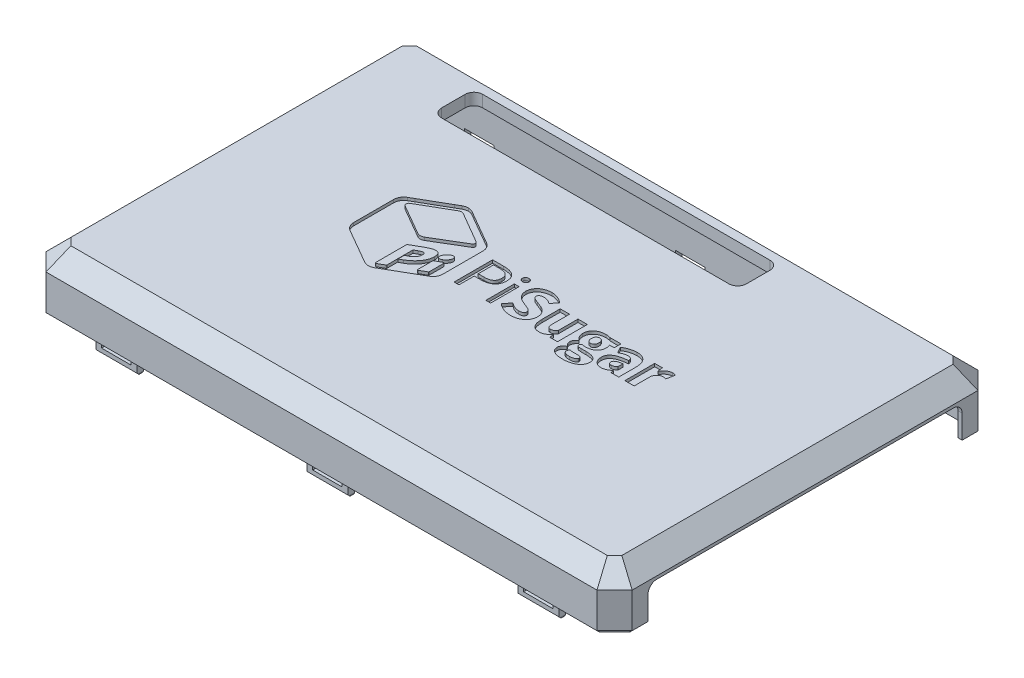
from build123d import *

# Parameters (mm, degrees)
SKETCH_1_W           = 100
SKETCH_1_H           = 65
EXTRUDE_1_DEPTH      = 2
SKETCH_4_W           = 100
SKETCH_4_H           = 65
SKETCH_4_W_2         = 95.8
SKETCH_4_H_2         = 60.8
EXTRUDE_2_DEPTH      = 7
CHAMFER_4_SIZE       = 2
CHAMFER_5_SIZE       = 3
CHAMFER_7_SIZE       = 3
SKETCH_24_W          = 56.6
SKETCH_24_H          = 6
CUT_EXTRUDE_8_DEPTH  = 1.4
FILLET_9_R           = 2
CUT_EXTRUDE_9_DEPTH  = 11.4
EXTRUDE_9_DEPTH      = 1
SKETCH_29_W          = 0.815007944
SKETCH_29_H          = 4.866639491
CUT_EXTRUDE_12_DEPTH = 0.5
SKETCH_30_W          = 2.416645626
SKETCH_30_H          = 1.5
EXTRUDE_10_DEPTH     = 3.3
CHAMFER_8_SIZE       = 1
CUT_EXTRUDE_13_REACH = 62.467
SKETCH_31_W          = 52
SKETCH_31_H          = 7
FILLET_10_R          = 1.5
SKETCH_33_W          = 1.5
SKETCH_33_H          = 10
EXTRUDE_11_DEPTH     = 2
SKETCH_21_W          = 20
SKETCH_21_H          = 2
CUT_EXTRUDE_15_DEPTH = 5
FILLET_11_R          = 1
CHAMFER_9_SIZE       = 1
CHAMFER_10_SIZE      = 0.8
SKETCH_34_W          = 7
SKETCH_34_H          = 2.8
EXTRUDE_12_DEPTH     = 1.1
SKETCH_35_W          = 7
SKETCH_35_H          = 2.8
EXTRUDE_13_DEPTH     = 1.1
CUT_EXTRUDE_16_REACH = 83.829
SKETCH_36_W          = 5
SKETCH_36_H          = 1.5
CUT_EXTRUDE_17_REACH = 83.829
SKETCH_37_W          = 5
SKETCH_37_H          = 1.5
CHAMFER_11_SIZE      = 0.6
FILLET_12_R          = 0.4


# Some blends are built 0.0001 mm under size
with BuildPart() as part:
    # 草图1 → 凸台-拉伸1 (new body)
    with BuildSketch(Plane(origin=(0, 0, 0), x_dir=(1, 0, 0), z_dir=(0, 1, 0))):
        Rectangle(SKETCH_1_W, SKETCH_1_H)
    extrude(amount=EXTRUDE_1_DEPTH)

    # 草图4 → 凸台-拉伸2 (add)
    with BuildSketch(Plane.XZ):
        Rectangle(SKETCH_4_W, SKETCH_4_H)
        Rectangle(SKETCH_4_W_2, SKETCH_4_H_2, mode=Mode.SUBTRACT)
    extrude(amount=EXTRUDE_2_DEPTH)

    # 倒角4
    chamfer_4_edges = [part.edges().sort_by_distance(p)[0] for p in [
        (47.9, -3.5, 30.4),
        (-47.9, -3.5, 30.4),
        (-47.9, -3.5, -30.4),
        (47.9, -3.5, -30.4),
    ]]
    chamfer(chamfer_4_edges, length=CHAMFER_4_SIZE)

    # 倒角5
    chamfer_5_edges = [part.edges().sort_by_distance(p)[0] for p in [
        (50, -2.5, 32.5),
        (-50, -2.5, 32.5),
        (-50, -2.5, -32.5),
        (50, -2.5, -32.5),
    ]]
    chamfer(chamfer_5_edges, length=CHAMFER_5_SIZE)

    # 倒角7
    chamfer_7_edges = [part.edges().sort_by_distance(p)[0] for p in [
        (-50, 2, 0),
        (0, 2, -32.5),
        (50, 2, 0),
        (0, 2, 32.5),
        (48.5, 2, 31),
        (48.5, 2, -31),
        (-48.5, 2, 31),
        (-48.5, 2, -31),
    ]]
    chamfer(chamfer_7_edges, length=CHAMFER_7_SIZE)

    # 草图24 → 切除-拉伸8 (cut)
    with BuildSketch(Plane.ZY.offset(-47.9)):
        with Locations((0, -4)):
            Rectangle(SKETCH_24_W, SKETCH_24_H)
    extrude(amount=-CUT_EXTRUDE_8_DEPTH, mode=Mode.SUBTRACT)

    # 圆角9
    fillet_9_edges = [part.edges().sort_by_distance(p)[0] for p in [
        (48.6, -1, -28.3),
        (48.6, -1, 28.3),
    ]]
    fillet(fillet_9_edges, radius=FILLET_9_R)

    # 草图25 → 切除-拉伸9 (cut)
    with BuildSketch(Plane.ZY.offset(-49.3)):
        with BuildLine():
            Line((26.8, -7), (26.8, -3))
            ThreePointArc((26.8, -3), (26.360660172, -1.939339828), (25.3, -1.5))
            Line((25.3, -1.5), (-25.3, -1.5))
            ThreePointArc((-25.3, -1.5), (-26.360660172, -1.939339828), (-26.8, -3))
            Line((-26.8, -3), (-26.8, -7))
            Line((-26.8, -7), (26.8, -7))
        make_face()
    extrude(amount=-CUT_EXTRUDE_9_DEPTH, mode=Mode.SUBTRACT)

    # 草图26 → 凸台-拉伸9 (add)
    with BuildSketch(Plane.XZ.offset(7)):
        Polygon((45.9, 30.4), (47.9, 28.4), (47.9, 28.3), (49, 28.3), (49, 28.855634919), (46.355634919, 31.5), (-46.355634919, 31.5), (-49, 28.855634919), (-49, -28.855634919), (-46.355634919, -31.5), (46.355634919, -31.5), (49, -28.855634919), (49, -28.3), (47.9, -28.3), (47.9, -28.4), (45.9, -30.4), (-45.9, -30.4), (-47.9, -28.4), (-47.9, 28.4), (-45.9, 30.4), align=None)
    extrude(amount=EXTRUDE_9_DEPTH)

    # 草图29 → 切除-拉伸12 (cut)
    # profile 1 of 9: a face of its own
    with BuildSketch(Plane(origin=(0, 2, 0), x_dir=(1, 0, 0), z_dir=(0, 1, 0))):
        with BuildLine():
            Line((-10.686897547, 6.359972587), (-11.507470584, 6.832970753))
            Line((-11.507470584, 6.832970753), (-15.764349736, 9.289089991))
            Line((-15.764349736, 9.289089991), (-16.584922773, 9.767792378))
            add(Edge.make_bspline(
                [(-16.584922773, 9.767792378), (-16.852812462, 9.915928211), (-17.149084128, 9.995717739), (-17.445425357, 9.995717739)],
                knots=[3, 3, 3, 3, 4, 4, 4, 4], degree=3))
            add(Edge.make_bspline(
                [(-17.445425357, 9.995717739), (-17.741766586, 9.995717739), (-18.038107815, 9.915928211), (-18.305927941, 9.767792378)],
                knots=[4, 4, 4, 4, 5, 5, 5, 5], degree=3))
            Line((-18.305927941, 9.767792378), (-19.126570542, 9.289089991))
            Line((-19.126570542, 9.289089991), (-23.383449693, 6.832970753))
            Line((-23.383449693, 6.832970753), (-24.204092294, 6.359972587))
            add(Edge.make_bspline(
                [(-24.204092294, 6.359972587), (-24.734028324, 6.052257698), (-25.064594878, 5.482392123), (-25.064594878, 4.872631784)],
                knots=[8, 8, 8, 8, 9, 9, 9, 9], degree=3))
            Line((-25.064594878, 4.872631784), (-25.064594878, -1.942973017))
            add(Edge.make_bspline(
                [(-25.064594878, -1.942973017), (-25.064594878, -2.558402795), (-24.734028324, -3.122598931), (-24.204092294, -3.43031382)],
                knots=[10, 10, 10, 10, 11, 11, 11, 11], degree=3))
            Line((-24.204092294, -3.43031382), (-23.383449693, -3.903311987))
            Line((-23.383449693, -3.903311987), (-19.126570542, -6.359431224))
            Line((-19.126570542, -6.359431224), (-18.305927941, -6.83809883))
            add(Edge.make_bspline(
                [(-18.305927941, -6.83809883), (-18.038107815, -6.991973665), (-17.741766586, -7.066058973), (-17.445425357, -7.066058973)],
                knots=[14, 14, 14, 14, 15, 15, 15, 15], degree=3))
            add(Edge.make_bspline(
                [(-17.445425357, -7.066058973), (-17.149084128, -7.066058973), (-16.852812462, -6.991973665), (-16.584922773, -6.83809883)],
                knots=[15, 15, 15, 15, 16, 16, 16, 16], degree=3))
            Line((-16.584922773, -6.83809883), (-15.764349736, -6.359431224))
            Line((-15.764349736, -6.359431224), (-11.507470584, -3.903311987))
            Line((-11.507470584, -3.903311987), (-10.686897547, -3.43031382))
            add(Edge.make_bspline(
                [(-10.686897547, -3.43031382), (-10.151187733, -3.122598931), (-9.826394963, -2.558402795), (-9.826394963, -1.942973017)],
                knots=[19, 19, 19, 19, 20, 20, 20, 20], degree=3))
            Line((-9.826394963, -1.942973017), (-9.826394963, 4.872631784))
            add(Edge.make_bspline(
                [(-9.826394963, 4.872631784), (-9.826394963, 5.482392123), (-10.151187733, 6.052257698), (-10.686897547, 6.359972587)],
                knots=[21, 21, 21, 21, 22, 22, 22, 22], degree=3))
        make_face()
        with BuildLine():
            Line((-23.109925347, 5.681831161), (-17.844372998, 8.724928637))
            add(Edge.make_bspline(
                [(-17.844372998, 8.724928637), (-17.599300192, 8.867395031), (-17.291550521, 8.867395031), (-17.040843059, 8.724928637)],
                knots=[3, 3, 3, 3, 4, 4, 4, 4], degree=3))
            Line((-17.040843059, 8.724928637), (-11.803811814, 5.676126941))
            add(Edge.make_bspline(
                [(-11.803811814, 5.676126941), (-11.535991689, 5.522286887), (-11.530287468, 5.13478247), (-11.798107593, 4.975203413)],
                knots=[5, 5, 5, 5, 6, 6, 6, 6], degree=3))
            Line((-11.798107593, 4.975203413), (-16.886968223, 1.93214072))
            add(Edge.make_bspline(
                [(-16.886968223, 1.93214072), (-17.228943219, 1.732666899), (-17.656342401, 1.732666899), (-17.998247833, 1.93214072)],
                knots=[7, 7, 7, 7, 8, 8, 8, 8], degree=3))
            add(Edge.make_bspline(
                [(-17.998247833, 1.93214072), (-23.149785329, 4.906822327), (-23.161193771, 4.912526548)],
                knots=[0, 0, 0, 1, 1, 1], degree=2))
            add(Edge.make_bspline(
                [(-23.161193771, 4.912526548), (-23.429013896, 5.106261365), (-23.400562356, 5.516582666), (-23.109925347, 5.681831161)],
                knots=[1, 1, 1, 1, 2, 2, 2, 2], degree=3))
        make_face(mode=Mode.SUBTRACT)
        with BuildLine():
            Line((-15.30842945, -3.225170561), (-15.901111909, -3.555667552))
            Line((-15.901111909, -3.555667552), (-15.901111909, -2.472943828))
            Line((-15.901111909, -2.472943828), (-15.3768801, -2.210793142))
            add(Edge.make_bspline(
                [(-14.419475326, -0.826023968), (-14.419475326, -1.367403221), (-14.727155433, -1.846070826), (-15.3768801, -2.210793142)],
                knots=[0, 0, 0, 0, 1, 1, 1, 1], degree=3))
            add(Edge.make_bspline(
                [(-15.411035862, -0.637958589), (-14.7727892, -0.273271055), (-14.419475326, -0.267566835), (-14.419475326, -0.826023968)],
                knots=[6, 6, 6, 6, 7, 7, 7, 7], degree=3))
            Line((-15.411035862, -0.637958589), (-15.901111909, -0.911517717))
            add(Edge.make_bspline(
                [(-15.958154117, -1.008385126), (-15.958154117, -0.968490362), (-15.935337234, -0.928595598), (-15.901111909, -0.911517717)],
                knots=[4, 4, 4, 4, 5, 5, 5, 5], degree=3))
            Line((-15.958154117, -1.008385126), (-15.958154117, -2.353259536))
            Line((-15.958154117, -2.353259536), (-15.958154117, -3.652569742))
            Line((-15.958154117, -3.652569742), (-15.958154117, -5.362166468))
            add(Edge.make_bspline(
                [(-15.958154117, -5.362166468), (-15.958154117, -5.402061232), (-15.975197216, -5.436251775), (-16.015057198, -5.459033877)],
                knots=[3, 3, 3, 3, 4, 4, 4, 4], degree=3))
            Line((-16.015057198, -5.459033877), (-17.120632587, -6.085872097))
            add(Edge.make_bspline(
                [(-17.120632587, -6.085872097), (-17.194717894, -6.125766861), (-17.285915864, -6.074498437), (-17.285915864, -5.989004688)],
                knots=[5, 5, 5, 5, 6, 6, 6, 6], degree=3))
            Line((-17.285915864, -5.989004688), (-17.285915864, -0.712043897))
            add(Edge.make_bspline(
                [(-17.285915864, -0.712043897), (-17.285915864, -0.672149133), (-17.268803202, -0.632254369), (-17.228943219, -0.615176488)],
                knots=[7, 7, 7, 7, 8, 8, 8, 8], degree=3))
            Line((-17.228943219, -0.615176488), (-15.348358996, 0.450469355))
            add(Edge.make_bspline(
                [(-15.348358996, 0.450469355), (-14.128838317, 1.140019223), (-13.120234683, 1.276781396), (-13.120234683, -0.090909898)],
                knots=[9, 9, 9, 9, 10, 10, 10, 10], degree=3))
            add(Edge.make_bspline(
                [(-13.120234683, -0.090909898), (-13.120234683, -1.407297985), (-14.140246759, -2.564107016), (-15.30842945, -3.225170561)],
                knots=[10, 10, 10, 10, 11, 11, 11, 11], degree=3))
        make_face(mode=Mode.SUBTRACT)
        with BuildLine():
            Line((-11.404933737, -2.871856687), (-12.49903112, -3.492990686))
            add(Edge.make_bspline(
                [(-12.49903112, -3.492990686), (-12.573116427, -3.53288545), (-12.664314397, -3.481582244), (-12.664314397, -3.396123277)],
                knots=[2, 2, 2, 2, 3, 3, 3, 3], degree=3))
            Line((-12.664314397, -3.396123277), (-12.664314397, -0.882996613))
            add(Edge.make_bspline(
                [(-12.664314397, -0.882996613), (-12.664314397, -0.843136631), (-12.641497514, -0.808911306), (-12.607272189, -0.786129204)],
                knots=[4, 4, 4, 4, 5, 5, 5, 5], degree=3))
            Line((-12.607272189, -0.786129204), (-11.513174805, -0.170664644))
            add(Edge.make_bspline(
                [(-11.513174805, -0.170664644), (-11.439089498, -0.130804662), (-11.347891528, -0.182073086), (-11.347891528, -0.267566835)],
                knots=[6, 6, 6, 6, 7, 7, 7, 7], degree=3))
            Line((-11.347891528, -0.267566835), (-11.347891528, -2.774954496))
            add(Edge.make_bspline(
                [(-11.347891528, -2.774954496), (-11.347891528, -2.81484926), (-11.370708412, -2.854744024), (-11.404933737, -2.871856687)],
                knots=[0, 0, 0, 0, 1, 1, 1, 1], degree=3))
        make_face(mode=Mode.SUBTRACT)
        with BuildLine():
            add(Edge.make_bspline(
                [(-12.003250852, 1.499037317), (-11.564443229, 1.749779562), (-11.251058901, 1.641503711), (-11.251058901, 1.242590852), (-11.251058901, 0.849382214), (-11.564443229, 0.38779249), (-12.003250852, 0.142754466)],
                knots=[2, 2, 2, 2, 3, 3, 3, 4, 4, 4, 4], degree=3))
            add(Edge.make_bspline(
                [(-12.003250852, 0.142754466), (-12.447693133, -0.113691999), (-12.761147024, -0.005416149), (-12.761147024, 0.38779249), (-12.761147024, 0.792409569), (-12.447693133, 1.248295073), (-12.003250852, 1.499037317)],
                knots=[0, 0, 0, 0, 1, 1, 1, 2, 2, 2, 2], degree=3))
        make_face(mode=Mode.SUBTRACT)
    # profile 2 of 9: a face of its own
    with BuildSketch(Plane(origin=(0, 2, 0), x_dir=(1, 0, 0), z_dir=(0, 1, 0))):
        with BuildLine():
            Line((-5.831631716, 4.393929396), (-7.706511719, 4.393929396))
            Line((-7.706511719, 4.393929396), (-7.706511719, -2.170898378))
            Line((-7.706511719, -2.170898378), (-6.874460676, -2.170898378))
            Line((-6.874460676, -2.170898378), (-6.874460676, 0.433391474))
            Line((-6.874460676, 0.433391474), (-5.785997949, 0.433391474))
            add(Edge.make_bspline(
                [(-5.785997949, 0.433391474), (-4.355629791, 0.433391474), (-3.369773476, 1.083011796), (-3.369773476, 2.467815752)],
                knots=[5, 5, 5, 5, 6, 6, 6, 6], degree=3))
            add(Edge.make_bspline(
                [(-3.369773476, 2.467815752), (-3.369773476, 3.903853349), (-4.355629791, 4.393929396), (-5.831631716, 4.393929396)],
                knots=[6, 6, 6, 6, 7, 7, 7, 7], degree=3))
        make_face()
        with BuildLine():
            Line((-5.894239018, 1.105828679), (-6.874460676, 1.105828679))
            Line((-6.874460676, 1.105828679), (-6.874460676, 3.721492192))
            Line((-6.874460676, 3.721492192), (-5.928464343, 3.721492192))
            add(Edge.make_bspline(
                [(-5.928464343, 3.721492192), (-4.777324751, 3.721492192), (-4.196050734, 3.419481523), (-4.196050734, 2.467815752)],
                knots=[3, 3, 3, 3, 4, 4, 4, 4], degree=3))
            add(Edge.make_bspline(
                [(-4.196050734, 2.467815752), (-4.196050734, 1.52752364), (-4.737464769, 1.105828679), (-5.894239018, 1.105828679)],
                knots=[4, 4, 4, 4, 5, 5, 5, 5], degree=3))
        make_face(mode=Mode.SUBTRACT)
    # profile 3 of 9: a face of its own
    with BuildSketch(Plane(origin=(0, 2, 0), x_dir=(1, 0, 0), z_dir=(0, 1, 0))):
        with Locations((-1.885284783, 0.262421368)):
            Rectangle(SKETCH_29_W, SKETCH_29_H)
    # profile 4 of 9: a face of its own
    with BuildSketch(Plane(origin=(0, 2, 0), x_dir=(1, 0, 0), z_dir=(0, 1, 0))):
        with BuildLine():
            Line((3.229244842, 1.618686828), (2.397263362, 1.9492186))
            add(Edge.make_bspline(
                [(2.397263362, 1.9492186), (1.810285125, 2.182882964), (1.388590164, 2.325349358), (1.388590164, 2.695741113)],
                knots=[1, 1, 1, 1, 2, 2, 2, 2], degree=3))
            add(Edge.make_bspline(
                [(1.388590164, 2.695741113), (1.388590164, 3.049054987), (1.690635614, 3.248528807), (2.186415882, 3.248528807)],
                knots=[2, 2, 2, 2, 3, 3, 3, 3], degree=3))
            add(Edge.make_bspline(
                [(2.186415882, 3.248528807), (2.70494347, 3.248528807), (3.115299552, 3.07187187), (3.554037612, 2.735635877)],
                knots=[3, 3, 3, 3, 4, 4, 4, 4], degree=3))
            Line((3.554037612, 2.735635877), (4.351932893, 3.738604854))
            add(Edge.make_bspline(
                [(4.351932893, 3.738604854), (3.770658876, 4.32554831), (2.955720496, 4.621889539), (2.186415882, 4.621889539)],
                knots=[5, 5, 5, 5, 6, 6, 6, 6], degree=3))
            add(Edge.make_bspline(
                [(2.186415882, 4.621889539), (0.767456165, 4.621889539), (-0.235512812, 3.721492192), (-0.235512812, 2.604577925)],
                knots=[6, 6, 6, 6, 7, 7, 7, 7], degree=3))
            add(Edge.make_bspline(
                [(-0.235512812, 2.604577925), (-0.235512812, 1.63579949), (0.419776948, 1.054525474), (1.120770039, 0.775296907)],
                knots=[7, 7, 7, 7, 8, 8, 8, 8], degree=3))
            Line((1.120770039, 0.775296907), (1.969864181, 0.416278812))
            add(Edge.make_bspline(
                [(1.969864181, 0.416278812), (2.539729756, 0.176945009), (2.910156293, 0.051556496), (2.910156293, -0.335947921)],
                knots=[9, 9, 9, 9, 10, 10, 10, 10], degree=3))
            add(Edge.make_bspline(
                [(2.910156293, -0.335947921), (2.910156293, -0.694966016), (2.630927726, -0.917187156), (2.038245267, -0.917187156)],
                knots=[10, 10, 10, 10, 11, 11, 11, 11], degree=3))
            add(Edge.make_bspline(
                [(2.038245267, -0.917187156), (1.514013459, -0.917187156), (0.892809896, -0.637958589), (0.419776948, -0.233376291)],
                knots=[11, 11, 11, 11, 12, 12, 12, 12], degree=3))
            Line((0.419776948, -0.233376291), (-0.486220275, -1.338916899))
            add(Edge.make_bspline(
                [(-0.486220275, -1.338916899), (0.203294811, -1.971459339), (1.137813138, -2.296286891), (2.004019942, -2.296286891)],
                knots=[13, 13, 13, 13, 14, 14, 14, 14], degree=3))
            add(Edge.make_bspline(
                [(2.004019942, -2.296286891), (3.616784041, -2.296286891), (4.551302368, -1.321804236), (4.551302368, -0.210559408)],
                knots=[14, 14, 14, 14, 15, 15, 15, 15], degree=3))
            add(Edge.make_bspline(
                [(4.551302368, -0.210559408), (4.551302368, 0.729697922), (4.055591664, 1.288189837), (3.229244842, 1.618686828)],
                knots=[15, 15, 15, 15, 16, 16, 16, 16], degree=3))
        make_face()
    # profile 5 of 9: a face of its own
    with BuildSketch(Plane(origin=(0, 2, 0), x_dir=(1, 0, 0), z_dir=(0, 1, 0))):
        with BuildLine():
            Line((8.335287698, 2.923701255), (8.335287698, -0.415737449))
            add(Edge.make_bspline(
                [(8.335287698, -0.415737449), (8.067467573, -0.791833425), (7.845142088, -0.934299819), (7.486193557, -0.934299819)],
                knots=[1, 1, 1, 1, 2, 2, 2, 2], degree=3))
            add(Edge.make_bspline(
                [(7.486193557, -0.934299819), (7.081541695, -0.934299819), (6.893511098, -0.73486078), (6.893511098, -0.02819825)],
                knots=[2, 2, 2, 2, 3, 3, 3, 3], degree=3))
            Line((6.893511098, -0.02819825), (6.893511098, 2.923701255))
            Line((6.893511098, 2.923701255), (5.303563883, 2.923701255))
            Line((5.303563883, 2.923701255), (5.303563883, -0.227672071))
            add(Edge.make_bspline(
                [(5.303563883, -0.227672071), (5.303563883, -1.498461173), (5.776596831, -2.296286891), (6.887806877, -2.296286891)],
                knots=[6, 6, 6, 6, 7, 7, 7, 7], degree=3))
            add(Edge.make_bspline(
                [(6.887806877, -2.296286891), (7.583026184, -2.296286891), (8.061763353, -1.971459339), (8.483458313, -1.469974851)],
                knots=[7, 7, 7, 7, 8, 8, 8, 8], degree=3))
            Line((8.483458313, -1.469974851), (8.517614075, -1.469974851))
            Line((8.517614075, -1.469974851), (8.631628928, -2.170898378))
            Line((8.631628928, -2.170898378), (9.930869571, -2.170898378))
            Line((9.930869571, -2.170898378), (9.930869571, 2.923701255))
            Line((9.930869571, 2.923701255), (8.335287698, 2.923701255))
        make_face()
    # profile 6 of 9: a face of its own
    with BuildSketch(Plane(origin=(0, 2, 0), x_dir=(1, 0, 0), z_dir=(0, 1, 0))):
        with BuildLine():
            Line((13.783166424, -1.1679294), (12.979636485, -1.1679294))
            add(Edge.make_bspline(
                [(12.979636485, -1.1679294), (12.432587793, -1.1679294), (12.227444534, -1.05965355), (12.227444534, -0.826023968)],
                knots=[1, 1, 1, 1, 2, 2, 2, 2], degree=3))
            add(Edge.make_bspline(
                [(12.227444534, -0.826023968), (12.227444534, -0.655071252), (12.267304516, -0.575281724), (12.386954027, -0.467005873)],
                knots=[2, 2, 2, 2, 3, 3, 3, 3], degree=3))
            add(Edge.make_bspline(
                [(12.386954027, -0.467005873), (12.609279512, -0.529682739), (12.814353208, -0.558203843), (12.985340706, -0.558203843)],
                knots=[3, 3, 3, 3, 4, 4, 4, 4], degree=3))
            add(Edge.make_bspline(
                [(12.985340706, -0.558203843), (14.113663415, -0.558203843), (15.019799765, -0.039606692), (15.019799765, 1.151392882)],
                knots=[4, 4, 4, 4, 5, 5, 5, 5], degree=3))
            add(Edge.make_bspline(
                [(15.019799765, 1.151392882), (15.019799765, 1.396465688), (14.957053336, 1.63009527), (14.877333371, 1.772561663)],
                knots=[5, 5, 5, 5, 6, 6, 6, 6], degree=3))
            Line((14.877333371, 1.772561663), (15.663681084, 1.772561663))
            Line((15.663681084, 1.772561663), (15.663681084, 2.923701255))
            Line((15.663681084, 2.923701255), (13.794574866, 2.923701255))
            add(Edge.make_bspline(
                [(13.794574866, 2.923701255), (13.560910502, 3.009160223), (13.281681935, 3.049054987), (12.985340706, 3.049054987)],
                knots=[9, 9, 9, 9, 10, 10, 10, 10], degree=3))
            add(Edge.make_bspline(
                [(12.985340706, 3.049054987), (11.885539102, 3.049054987), (10.85404902, 2.444998868), (10.85404902, 1.196991867)],
                knots=[10, 10, 10, 10, 11, 11, 11, 11], degree=3))
            add(Edge.make_bspline(
                [(10.85404902, 1.196991867), (10.85404902, 0.604344191), (11.184615574, 0.131346024), (11.543564106, -0.11939622)],
                knots=[11, 11, 11, 11, 12, 12, 12, 12], degree=3))
            Line((11.543564106, -0.11939622), (11.543564106, -0.153586763))
            add(Edge.make_bspline(
                [(11.543564106, -0.153586763), (11.213067115, -0.387216345), (10.979402751, -0.74623444), (10.979402751, -1.105252535)],
                knots=[13, 13, 13, 13, 14, 14, 14, 14], degree=3))
            add(Edge.make_bspline(
                [(10.979402751, -1.105252535), (10.979402751, -1.532651716), (11.178911353, -1.800506623), (11.446731479, -1.982867781)],
                knots=[14, 14, 14, 14, 15, 15, 15, 15], degree=3))
            Line((11.446731479, -1.982867781), (11.446731479, -2.028431984))
            add(Edge.make_bspline(
                [(11.446731479, -2.028431984), (10.97369853, -2.267800569), (10.722991068, -2.609706001), (10.722991068, -3.031400961)],
                knots=[16, 16, 16, 16, 17, 17, 17, 17], degree=3))
            add(Edge.make_bspline(
                [(10.722991068, -3.031400961), (10.722991068, -3.943171969), (11.686030499, -4.313598506), (12.859986975, -4.313598506)],
                knots=[17, 17, 17, 17, 18, 18, 18, 18], degree=3))
            add(Edge.make_bspline(
                [(12.859986975, -4.313598506), (14.632260566, -4.313598506), (15.743540176, -3.549998113), (15.743540176, -2.472943828)],
                knots=[18, 18, 18, 18, 19, 19, 19, 19], degree=3))
            add(Edge.make_bspline(
                [(15.743540176, -2.472943828), (15.743540176, -1.549764379), (15.036912428, -1.1679294), (13.783166424, -1.1679294)],
                knots=[19, 19, 19, 19, 20, 20, 20, 20], degree=3))
        make_face()
        with BuildLine():
            Line((12.996749148, -2.387450079), (13.481190538, -2.387450079))
            add(Edge.make_bspline(
                [(13.481190538, -2.387450079), (13.954084358, -2.387450079), (14.221974047, -2.450126945), (14.221974047, -2.752172395)],
                knots=[4, 4, 4, 4, 5, 5, 5, 5], degree=3))
            add(Edge.make_bspline(
                [(14.221974047, -2.752172395), (14.221974047, -3.076999946), (13.766123325, -3.316333749), (13.110694437, -3.316333749)],
                knots=[5, 5, 5, 5, 6, 6, 6, 6], degree=3))
            add(Edge.make_bspline(
                [(13.110694437, -3.316333749), (12.455404677, -3.316333749), (12.028005495, -3.139676812), (12.028005495, -2.780658717)],
                knots=[0, 0, 0, 0, 1, 1, 1, 1], degree=3))
            add(Edge.make_bspline(
                [(12.028005495, -2.780658717), (12.028005495, -2.609706001), (12.10772546, -2.467239607), (12.267304516, -2.324773213)],
                knots=[1, 1, 1, 1, 2, 2, 2, 2], degree=3))
            add(Edge.make_bspline(
                [(12.267304516, -2.324773213), (12.432587793, -2.370372198), (12.626392175, -2.387450079), (12.996749148, -2.387450079)],
                knots=[2, 2, 2, 2, 3, 3, 3, 3], degree=3))
        make_face(mode=Mode.SUBTRACT)
        with BuildLine():
            add(Edge.make_bspline(
                [(12.985340706, 0.399200931), (12.620687954, 0.399200931), (12.341459387, 0.667021056), (12.341459387, 1.196991867), (12.341459387, 1.715589019), (12.620687954, 1.983409144), (12.985340706, 1.983409144)],
                knots=[2, 2, 2, 2, 3, 3, 3, 4, 4, 4, 4], degree=3))
            add(Edge.make_bspline(
                [(12.985340706, 1.983409144), (13.361471463, 1.983409144), (13.629291588, 1.715589019), (13.629291588, 1.196991867), (13.629291588, 0.667021056), (13.361471463, 0.399200931), (12.985340706, 0.399200931)],
                knots=[0, 0, 0, 0, 1, 1, 1, 2, 2, 2, 2], degree=3))
        make_face(mode=Mode.SUBTRACT)
    # profile 7 of 9: a face of its own
    with BuildSketch(Plane(origin=(0, 2, 0), x_dir=(1, 0, 0), z_dir=(0, 1, 0))):
        with BuildLine():
            Line((16.119601369, 2.382322003), (16.678058503, 1.33375404))
            add(Edge.make_bspline(
                [(16.678058503, 1.33375404), (17.185316776, 1.618686828), (17.607011737, 1.778265884), (18.011594035, 1.778265884)],
                knots=[2, 2, 2, 2, 3, 3, 3, 3], degree=3))
            add(Edge.make_bspline(
                [(18.011594035, 1.778265884), (18.530121622, 1.778265884), (18.746742887, 1.538932082), (18.780898648, 1.128610781)],
                knots=[3, 3, 3, 3, 4, 4, 4, 4], degree=3))
            add(Edge.make_bspline(
                [(18.780898648, 1.128610781), (16.792073356, 0.91205908), (15.948613871, 0.330819845), (15.948613871, -0.74623444)],
                knots=[4, 4, 4, 4, 5, 5, 5, 5], degree=3))
            add(Edge.make_bspline(
                [(15.948613871, -0.74623444), (15.948613871, -1.595328582), (16.524183667, -2.296286891), (17.464545343, -2.296286891)],
                knots=[5, 5, 5, 5, 6, 6, 6, 6], degree=3))
            add(Edge.make_bspline(
                [(17.464545343, -2.296286891), (18.028706697, -2.296286891), (18.501670082, -2.034136205), (18.923365042, -1.658040229)],
                knots=[6, 6, 6, 6, 7, 7, 7, 7], degree=3))
            Line((18.923365042, -1.658040229), (18.963225024, -1.658040229))
            Line((18.963225024, -1.658040229), (19.077170314, -2.170898378))
            Line((19.077170314, -2.170898378), (20.376480521, -2.170898378))
            Line((20.376480521, -2.170898378), (20.376480521, 0.723993701))
            add(Edge.make_bspline(
                [(20.376480521, 0.723993701), (20.376480521, 2.319645137), (19.62999279, 3.049054987), (18.313639485, 3.049054987)],
                knots=[11, 11, 11, 11, 12, 12, 12, 12], degree=3))
            add(Edge.make_bspline(
                [(18.313639485, 3.049054987), (17.521448424, 3.049054987), (16.792073356, 2.781234862), (16.119601369, 2.382322003)],
                knots=[0, 0, 0, 0, 1, 1, 1, 1], degree=3))
        make_face()
        with BuildLine():
            Line((18.780898648, 0.159832347), (18.780898648, -0.655071252))
            add(Edge.make_bspline(
                [(18.780898648, -0.655071252), (18.547234285, -0.905813496), (18.336386804, -1.05965355), (18.011594035, -1.05965355)],
                knots=[0, 0, 0, 0, 1, 1, 1, 1], degree=3))
            add(Edge.make_bspline(
                [(18.011594035, -1.05965355), (17.68102748, -1.05965355), (17.464545343, -0.917187156), (17.464545343, -0.620880709)],
                knots=[1, 1, 1, 1, 2, 2, 2, 2], degree=3))
            add(Edge.make_bspline(
                [(17.464545343, -0.620880709), (17.464545343, -0.261862614), (17.789338113, 0.023070174), (18.780898648, 0.159832347)],
                knots=[2, 2, 2, 2, 3, 3, 3, 3], degree=3))
        make_face(mode=Mode.SUBTRACT)
    # profile 8 of 9: a face of its own
    with BuildSketch(Plane(origin=(0, 2, 0), x_dir=(1, 0, 0), z_dir=(0, 1, 0))):
        with BuildLine():
            Line((22.866859865, 2.04041657), (22.83263454, 2.04041657))
            Line((22.83263454, 2.04041657), (22.724393471, 2.923701255))
            Line((22.724393471, 2.923701255), (21.425083265, 2.923701255))
            Line((21.425083265, 2.923701255), (21.425083265, -2.170898378))
            Line((21.425083265, -2.170898378), (23.009326259, -2.170898378))
            Line((23.009326259, -2.170898378), (23.009326259, 0.741106364))
            add(Edge.make_bspline(
                [(23.009326259, 0.741106364), (23.277146384, 1.413543568), (23.73306667, 1.652877371), (24.109127863, 1.652877371)],
                knots=[7, 7, 7, 7, 8, 8, 8, 8], degree=3))
            add(Edge.make_bspline(
                [(24.109127863, 1.652877371), (24.337088006, 1.652877371), (24.485258621, 1.618686828), (24.667584997, 1.573122625)],
                knots=[8, 8, 8, 8, 9, 9, 9, 9], degree=3))
            Line((24.667584997, 1.573122625), (24.935405122, 2.946483357))
            add(Edge.make_bspline(
                [(24.935405122, 2.946483357), (24.792938728, 3.009160223), (24.622020794, 3.049054987), (24.319975344, 3.049054987)],
                knots=[10, 10, 10, 10, 11, 11, 11, 11], degree=3))
            add(Edge.make_bspline(
                [(24.319975344, 3.049054987), (23.807082413, 3.049054987), (23.242921059, 2.718523214), (22.866859865, 2.04041657)],
                knots=[0, 0, 0, 0, 1, 1, 1, 1], degree=3))
        make_face()
    # profile 9 of 9: a face of its own
    with BuildSketch(Plane(origin=(0, 2, 0), x_dir=(1, 0, 0), z_dir=(0, 1, 0))):
        with BuildLine():
            add(Edge.make_bspline(
                [(-1.882432672, 3.69871009), (-1.557639902, 3.69871009), (-1.318271318, 3.920966012), (-1.318271318, 4.22297668), (-1.318271318, 4.559212674), (-1.557639902, 4.752947491), (-1.882432672, 4.752947491)],
                knots=[2, 2, 2, 2, 3, 3, 3, 4, 4, 4, 4], degree=3))
            add(Edge.make_bspline(
                [(-1.882432672, 4.752947491), (-2.207225442, 4.752947491), (-2.446594027, 4.559212674), (-2.446594027, 4.22297668), (-2.446594027, 3.920966012), (-2.207225442, 3.69871009), (-1.882432672, 3.69871009)],
                knots=[0, 0, 0, 0, 1, 1, 1, 2, 2, 2, 2], degree=3))
        make_face()
    extrude(amount=-CUT_EXTRUDE_12_DEPTH, mode=Mode.SUBTRACT)

    # 草图30 → 凸台-拉伸10 (add)
    with BuildSketch(Plane.XZ):
        with Locations((46.591677187, 10)):
            Rectangle(SKETCH_30_W, SKETCH_30_H)
        with Locations((46.591677187, -8)):
            Rectangle(SKETCH_30_W, SKETCH_30_H)
    extrude(amount=EXTRUDE_10_DEPTH)

    # 倒角8
    chamfer_8_edges = [part.edges().sort_by_distance(p)[0] for p in [
        (47.8, -3.3, 10),
        (47.8, -3.3, -8),
    ]]
    chamfer(chamfer_8_edges, length=CHAMFER_8_SIZE)

    # 草图31 → 切除-拉伸13 (cut, up to next)
    with BuildSketch(Plane(origin=(0, 2, 0), x_dir=(1, 0, 0), z_dir=(0, 1, 0)), mode=Mode.PRIVATE) as cut_extrude_13_sk1:
        with Locations((-8.5, 24.5)):
            Rectangle(SKETCH_31_W, SKETCH_31_H)
    cut_extrude_13_tool1 = extrude(cut_extrude_13_sk1.sketch, amount=-CUT_EXTRUDE_13_REACH, mode=Mode.PRIVATE) & part.part
    add(cut_extrude_13_tool1.solids().sort_by_distance((-8.5, 2, -24.5))[0], mode=Mode.SUBTRACT)

    # 圆角10
    fillet_10_edges = [part.edges().sort_by_distance(p)[0] for p in [
        (-34.5, 1, -21),
        (-34.5, 1, -28),
        (17.5, 1, -28),
        (17.5, 1, -21),
    ]]
    fillet(fillet_10_edges, radius=FILLET_10_R)

    # 草图33 → 凸台-拉伸11 (add)
    with BuildSketch(Plane(origin=(-47.9, 0, 0), x_dir=(0, 0, -1), z_dir=(1, 0, 0))):
        with Locations((-6.75, -5)):
            Rectangle(SKETCH_33_W, SKETCH_33_H)
        with Locations((6.75, -5)):
            Rectangle(SKETCH_33_W, SKETCH_33_H)
    extrude(amount=EXTRUDE_11_DEPTH)

    # 草图21 → 切除-拉伸15 (cut)
    with BuildSketch(Plane.ZY.offset(50)):
        with Locations((0, -3)):
            Rectangle(SKETCH_21_W, SKETCH_21_H)
    extrude(amount=-CUT_EXTRUDE_15_DEPTH, mode=Mode.SUBTRACT)

    # 圆角11
    fillet_11_edges = [part.edges().sort_by_distance(p)[0] for p in [
        (-48.95, -2, -10),
        (-48.95, -4, -10),
        (-48.95, -2, 10),
        (-48.95, -4, 10),
    ]]
    fillet(fillet_11_edges, radius=FILLET_11_R - 0.0001)  # a hair under: the kernel refuses the full size

    # 倒角9
    chamfer_9_edges = [part.edges().sort_by_distance(p)[0] for p in [
        (-47.9, -10, 6.75),
        (-47.9, -10, -6.75),
    ]]
    chamfer(chamfer_9_edges, length=CHAMFER_9_SIZE)

    # 倒角10
    # the kernel refuses this chamfer: 0.8 mm, written as the material it adds along each edge
    with BuildSketch(Plane(origin=(-47.95734639, 0, -30.4), x_dir=(0, 0.027495876610586306, 0.9996219169112966), z_dir=(1, 0, 0))) as chamfer_10_piece_1_section:
        Polygon((CHAMFER_10_SIZE * 0.999621916911, CHAMFER_10_SIZE * 0.0274958766106), (-CHAMFER_10_SIZE * 0.0274958766106, CHAMFER_10_SIZE * 0.999621916911), (0, 0), align=None)
    chamfer_10_piece_1 = extrude(amount=95.914692781, mode=Mode.PRIVATE)
    chamfer_10_piece_1 = split(chamfer_10_piece_1, bisect_by=Plane(origin=(-12.082450574, 16.820883879, -42.215013751), z_dir=(0.4999999999999997, -0.7071067811865478, 0.4999999999999999)), keep=Keep.TOP, mode=Mode.PRIVATE)
    chamfer_10_piece_1 = split(chamfer_10_piece_1, bisect_by=Plane(origin=(12.082450574, 16.820883879, -42.215013751), z_dir=(-0.4999999999999999, -0.7071067811865477, 0.4999999999999999)), keep=Keep.TOP, mode=Mode.PRIVATE)
    add(chamfer_10_piece_1)
    with BuildSketch(Plane(origin=(44.445236416, 0, -31.854763584), x_dir=(-0.7068394360706735, 0.02749587661058641, 0.7068394360706735), z_dir=(0.7071067811865476, 0, 0.7071067811865476))) as chamfer_10_piece_2_section:
        Polygon((CHAMFER_10_SIZE * 0.999621916911, CHAMFER_10_SIZE * 0.0274958766106), (-CHAMFER_10_SIZE * 0.0274958766106, CHAMFER_10_SIZE * 0.999621916911), (0, 0), align=None)
    chamfer_10_piece_2 = extrude(amount=6.943119905, mode=Mode.PRIVATE)
    chamfer_10_piece_2 = split(chamfer_10_piece_2, bisect_by=Plane(origin=(46.696480806, 1.023714498, -30.476285502), z_dir=(0, -0.7071067811865476, 0.7071067811865476)), keep=Keep.TOP, mode=Mode.PRIVATE)
    chamfer_10_piece_2 = split(chamfer_10_piece_2, bisect_by=Plane(origin=(47.976285502, 1.023714498, -29.196480806), z_dir=(-0.7071067811865476, -0.7071067811865476, 0)), keep=Keep.TOP, mode=Mode.PRIVATE)
    add(chamfer_10_piece_2)
    with BuildSketch(Plane(origin=(47.9, 0, -30.45734639), x_dir=(-0.9996219169112966, 0.027495876610586487, 0), z_dir=(0, 0, 1))) as chamfer_10_piece_3_section:
        Polygon((CHAMFER_10_SIZE * 0.999621916911, CHAMFER_10_SIZE * 0.0274958766106), (-CHAMFER_10_SIZE * 0.0274958766106, CHAMFER_10_SIZE * 0.999621916911), (0, 0), align=None)
    chamfer_10_piece_3 = extrude(amount=60.914692781, mode=Mode.PRIVATE)
    chamfer_10_piece_3 = split(chamfer_10_piece_3, bisect_by=Plane(origin=(59.96326685, 17.300714403, -6.34438536), z_dir=(-0.4999999999999997, -0.7071067811865478, -0.4999999999999999)), keep=Keep.TOP, mode=Mode.PRIVATE)
    chamfer_10_piece_3 = split(chamfer_10_piece_3, bisect_by=Plane(origin=(50.592092955, 4.047873186, -21.769136324), z_dir=(-0.4999999999999999, -0.7071067811865477, 0.4999999999999999)), keep=Keep.TOP, mode=Mode.PRIVATE)
    add(chamfer_10_piece_3)
    with BuildSketch(Plane(origin=(49.354763584, 0, 26.945236416), x_dir=(-0.7068394360706735, 0.02749587661058641, -0.7068394360706735), z_dir=(-0.7071067811865476, 0, 0.7071067811865476))) as chamfer_10_piece_4_section:
        Polygon((CHAMFER_10_SIZE * 0.999621916911, CHAMFER_10_SIZE * 0.0274958766106), (-CHAMFER_10_SIZE * 0.0274958766106, CHAMFER_10_SIZE * 0.999621916911), (0, 0), align=None)
    chamfer_10_piece_4 = extrude(amount=6.943119905, mode=Mode.PRIVATE)
    chamfer_10_piece_4 = split(chamfer_10_piece_4, bisect_by=Plane(origin=(46.696480806, 1.023714498, 30.476285502), z_dir=(0, -0.7071067811865476, -0.7071067811865476)), keep=Keep.TOP, mode=Mode.PRIVATE)
    chamfer_10_piece_4 = split(chamfer_10_piece_4, bisect_by=Plane(origin=(47.976285502, 1.023714498, 29.196480806), z_dir=(-0.7071067811865476, -0.7071067811865476, 0)), keep=Keep.TOP, mode=Mode.PRIVATE)
    add(chamfer_10_piece_4)
    with BuildSketch(Plane(origin=(47.95734639, 0, 30.4), x_dir=(0, 0.027495876610586306, -0.9996219169112966), z_dir=(-1, 0, 0))) as chamfer_10_piece_5_section:
        Polygon((CHAMFER_10_SIZE * 0.999621916911, CHAMFER_10_SIZE * 0.0274958766106), (-CHAMFER_10_SIZE * 0.0274958766106, CHAMFER_10_SIZE * 0.999621916911), (0, 0), align=None)
    chamfer_10_piece_5 = extrude(amount=95.914692781, mode=Mode.PRIVATE)
    chamfer_10_piece_5 = split(chamfer_10_piece_5, bisect_by=Plane(origin=(-12.082450574, 16.820883879, 42.215013751), z_dir=(0.4999999999999997, -0.7071067811865478, -0.4999999999999999)), keep=Keep.TOP, mode=Mode.PRIVATE)
    chamfer_10_piece_5 = split(chamfer_10_piece_5, bisect_by=Plane(origin=(12.082450574, 16.820883879, 42.215013751), z_dir=(-0.4999999999999997, -0.7071067811865478, -0.4999999999999999)), keep=Keep.TOP, mode=Mode.PRIVATE)
    add(chamfer_10_piece_5)
    with BuildSketch(Plane(origin=(-44.445236416, 0, 31.854763584), x_dir=(0.7068394360706735, 0.02749587661058654, -0.7068394360706735), z_dir=(-0.7071067811865476, 0, -0.7071067811865476))) as chamfer_10_piece_6_section:
        Polygon((CHAMFER_10_SIZE * 0.999621916911, CHAMFER_10_SIZE * 0.0274958766106), (-CHAMFER_10_SIZE * 0.0274958766106, CHAMFER_10_SIZE * 0.999621916911), (0, 0), align=None)
    chamfer_10_piece_6 = extrude(amount=6.943119905, mode=Mode.PRIVATE)
    chamfer_10_piece_6 = split(chamfer_10_piece_6, bisect_by=Plane(origin=(-47.976285502, 1.023714498, 29.196480806), z_dir=(0.7071067811865476, -0.7071067811865476, 0)), keep=Keep.TOP, mode=Mode.PRIVATE)
    chamfer_10_piece_6 = split(chamfer_10_piece_6, bisect_by=Plane(origin=(-46.696480806, 1.023714498, 30.476285502), z_dir=(0, -0.7071067811865476, -0.7071067811865476)), keep=Keep.TOP, mode=Mode.PRIVATE)
    add(chamfer_10_piece_6)
    with BuildSketch(Plane(origin=(-47.9, 0, 30.45734639), x_dir=(0.9996219169112966, 0.027495876610586487, 0), z_dir=(0, 0, -1))) as chamfer_10_piece_7_section:
        Polygon((CHAMFER_10_SIZE * 0.999621916911, CHAMFER_10_SIZE * 0.0274958766106), (-CHAMFER_10_SIZE * 0.0274958766106, CHAMFER_10_SIZE * 0.999621916911), (0, 0), align=None)
    chamfer_10_piece_7 = extrude(amount=25.014692781, mode=Mode.PRIVATE)
    chamfer_10_piece_7 = split(chamfer_10_piece_7, bisect_by=Plane(origin=(-50.818127416, 4.240527796, 21.270647101), z_dir=(0.4999999999999997, -0.7071067811865478, -0.4999999999999999)), keep=Keep.TOP, mode=Mode.PRIVATE)
    add(chamfer_10_piece_7)
    with BuildSketch(Plane(origin=(-47.9, 0, 8.05734639), x_dir=(0.9996219169112966, 0.027495876610586487, 0), z_dir=(0, 0, -1))) as chamfer_10_piece_8:
        Polygon((CHAMFER_10_SIZE * 0.999621916911, CHAMFER_10_SIZE * 0.0274958766106), (-CHAMFER_10_SIZE * 0.0274958766106, CHAMFER_10_SIZE * 0.999621916911), (0, 0), align=None)
    extrude(amount=16.114692781)
    with BuildSketch(Plane(origin=(-47.9, 0, -5.44265361), x_dir=(-0.02749587661058735, -0.9996219169112966, 0), z_dir=(0, 0, -1))) as chamfer_10_piece_9_section:
        Polygon((CHAMFER_10_SIZE * 0.999621916911, -CHAMFER_10_SIZE * 0.0274958766106), (-CHAMFER_10_SIZE * 0.0274958766106, -CHAMFER_10_SIZE * 0.999621916911), (0, 0), align=None)
    chamfer_10_piece_9 = extrude(amount=25.014692781, mode=Mode.PRIVATE)
    chamfer_10_piece_9 = split(chamfer_10_piece_9, bisect_by=Plane(origin=(-53.910395812, 8.610440223, -11.998389284), z_dir=(0.4999999999999997, -0.7071067811865478, 0.4999999999999999)), keep=Keep.TOP, mode=Mode.PRIVATE)
    add(chamfer_10_piece_9)
    with BuildSketch(Plane(origin=(-44.445236416, 0, -31.854763584), x_dir=(-0.01944252080601638, -0.9996219169112966, -0.01944252080601638), z_dir=(-0.7071067811865476, 0, 0.7071067811865476))) as chamfer_10_piece_10_section:
        Polygon((CHAMFER_10_SIZE * 0.999621916911, CHAMFER_10_SIZE * 0.0274958766106), (-CHAMFER_10_SIZE * 0.0274958766106, CHAMFER_10_SIZE * 0.999621916911), (0, 0), align=None)
    chamfer_10_piece_10 = extrude(amount=6.943119905, mode=Mode.PRIVATE)
    chamfer_10_piece_10 = split(chamfer_10_piece_10, bisect_by=Plane(origin=(-47.976285502, 1.023714498, -29.196480806), z_dir=(0.7071067811865476, -0.7071067811865476, 0)), keep=Keep.TOP, mode=Mode.PRIVATE)
    chamfer_10_piece_10 = split(chamfer_10_piece_10, bisect_by=Plane(origin=(-46.696480806, 1.023714498, -30.476285502), z_dir=(0, -0.7071067811865476, 0.7071067811865476)), keep=Keep.TOP, mode=Mode.PRIVATE)
    add(chamfer_10_piece_10)

    # 草图34 → 凸台-拉伸12 (add)
    with BuildSketch(Plane.XY.offset(-30.4)):
        with Locations((36, -8.4)):
            Rectangle(SKETCH_34_W, SKETCH_34_H)
        with Locations((0, -8.4)):
            Rectangle(SKETCH_34_W, SKETCH_34_H)
        with Locations((-36, -8.4)):
            Rectangle(SKETCH_34_W, SKETCH_34_H)
    extrude(amount=-EXTRUDE_12_DEPTH)

    # 草图35 → 凸台-拉伸13 (add)
    with BuildSketch(Plane(origin=(0, 0, 30.4), x_dir=(-1, 0, 0), z_dir=(0, 0, -1))):
        with Locations((36, -8.4)):
            Rectangle(SKETCH_35_W, SKETCH_35_H)
        with Locations((0, -8.4)):
            Rectangle(SKETCH_35_W, SKETCH_35_H)
        with Locations((-36, -8.4)):
            Rectangle(SKETCH_35_W, SKETCH_35_H)
    extrude(amount=-EXTRUDE_13_DEPTH)

    # 草图36 → 切除-拉伸16 (cut, up to next)
    with BuildSketch(Plane.XY.offset(31.5), mode=Mode.PRIVATE) as cut_extrude_16_sk1:
        with Locations((-36, -7.75)):
            Rectangle(SKETCH_36_W, SKETCH_36_H)
    cut_extrude_16_tool1 = extrude(cut_extrude_16_sk1.sketch, amount=-CUT_EXTRUDE_16_REACH, mode=Mode.PRIVATE) & part.part
    # 草图36 → 切除-拉伸16 (cut, up to next)
    with BuildSketch(Plane.XY.offset(31.5), mode=Mode.PRIVATE) as cut_extrude_16_sk2:
        with Locations((0, -7.75)):
            Rectangle(SKETCH_36_W, SKETCH_36_H)
    cut_extrude_16_tool2 = extrude(cut_extrude_16_sk2.sketch, amount=-CUT_EXTRUDE_16_REACH, mode=Mode.PRIVATE) & part.part
    # 草图36 → 切除-拉伸16 (cut, up to next)
    with BuildSketch(Plane.XY.offset(31.5), mode=Mode.PRIVATE) as cut_extrude_16_sk3:
        with Locations((36, -7.75)):
            Rectangle(SKETCH_36_W, SKETCH_36_H)
    cut_extrude_16_tool3 = extrude(cut_extrude_16_sk3.sketch, amount=-CUT_EXTRUDE_16_REACH, mode=Mode.PRIVATE) & part.part
    add(cut_extrude_16_tool1.solids().sort_by_distance((-36, -7.75, 31.5))[0], mode=Mode.SUBTRACT)
    add(cut_extrude_16_tool2.solids().sort_by_distance((0, -7.75, 31.5))[0], mode=Mode.SUBTRACT)
    add(cut_extrude_16_tool3.solids().sort_by_distance((36, -7.75, 31.5))[0], mode=Mode.SUBTRACT)

    # 草图37 → 切除-拉伸17 (cut, up to next)
    with BuildSketch(Plane(origin=(0, 0, -31.5), x_dir=(-1, 0, 0), z_dir=(0, 0, -1)), mode=Mode.PRIVATE) as cut_extrude_17_sk1:
        with Locations((-36, -7.75)):
            Rectangle(SKETCH_37_W, SKETCH_37_H)
    cut_extrude_17_tool1 = extrude(cut_extrude_17_sk1.sketch, amount=-CUT_EXTRUDE_17_REACH, mode=Mode.PRIVATE) & part.part
    # 草图37 → 切除-拉伸17 (cut, up to next)
    with BuildSketch(Plane(origin=(0, 0, -31.5), x_dir=(-1, 0, 0), z_dir=(0, 0, -1)), mode=Mode.PRIVATE) as cut_extrude_17_sk2:
        with Locations((0, -7.75)):
            Rectangle(SKETCH_37_W, SKETCH_37_H)
    cut_extrude_17_tool2 = extrude(cut_extrude_17_sk2.sketch, amount=-CUT_EXTRUDE_17_REACH, mode=Mode.PRIVATE) & part.part
    # 草图37 → 切除-拉伸17 (cut, up to next)
    with BuildSketch(Plane(origin=(0, 0, -31.5), x_dir=(-1, 0, 0), z_dir=(0, 0, -1)), mode=Mode.PRIVATE) as cut_extrude_17_sk3:
        with Locations((36, -7.75)):
            Rectangle(SKETCH_37_W, SKETCH_37_H)
    cut_extrude_17_tool3 = extrude(cut_extrude_17_sk3.sketch, amount=-CUT_EXTRUDE_17_REACH, mode=Mode.PRIVATE) & part.part
    add(cut_extrude_17_tool1.solids().sort_by_distance((36, -7.75, -31.5))[0], mode=Mode.SUBTRACT)
    add(cut_extrude_17_tool2.solids().sort_by_distance((0, -7.75, -31.5))[0], mode=Mode.SUBTRACT)
    add(cut_extrude_17_tool3.solids().sort_by_distance((-36, -7.75, -31.5))[0], mode=Mode.SUBTRACT)

    # 倒角11
    chamfer_11_edges = [part.edges().sort_by_distance(p)[0] for p in [
        (36, -9.8, -31.5),
        (0, -9.8, -31.5),
        (-36, -9.8, -31.5),
        (-36, -9.8, 31.5),
        (0, -9.8, 31.5),
        (36, -9.8, 31.5),
    ]]
    chamfer(chamfer_11_edges, length=CHAMFER_11_SIZE)

    # 圆角12
    fillet_12_edges = [part.edges().sort_by_distance(p)[0] for p in [
        (32.5, -9.8, -30.65),
        (39.5, -9.8, -30.65),
        (-3.5, -9.8, -30.65),
        (3.5, -9.8, -30.65),
        (-39.5, -9.8, -30.65),
        (-32.5, -9.8, -30.65),
        (39.5, -9.8, 30.65),
        (32.5, -9.8, 30.65),
        (3.5, -9.8, 30.65),
        (-3.5, -9.8, 30.65),
        (-32.5, -9.8, 30.65),
        (-39.5, -9.8, 30.65),
    ]]
    fillet(fillet_12_edges, radius=FILLET_12_R)


solid = part.part
